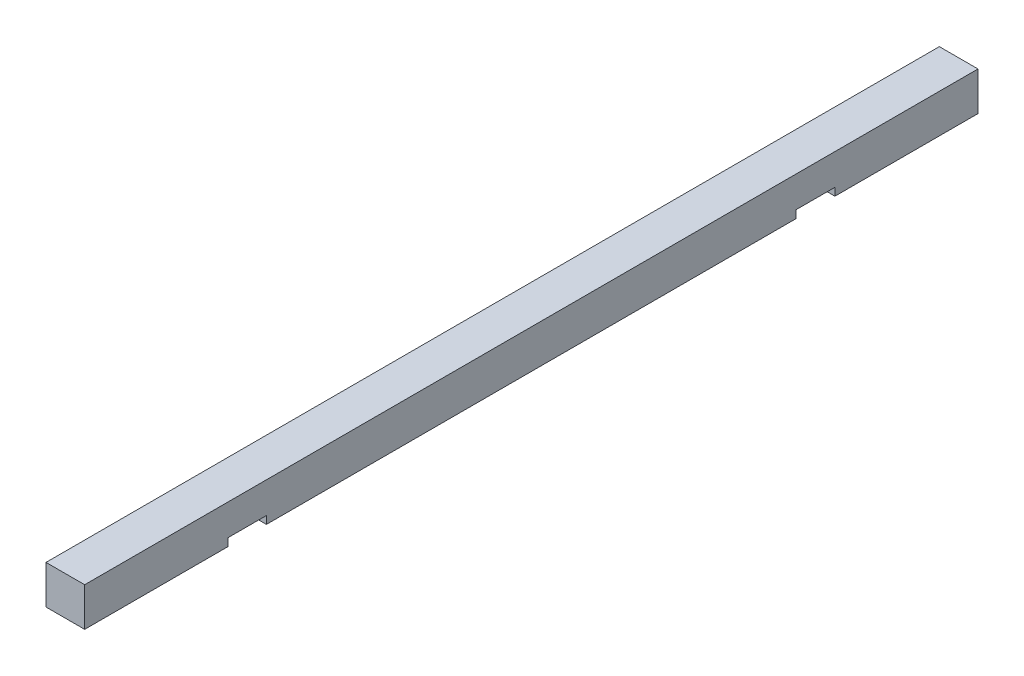
from build123d import *

# Parameters (mm, degrees)
ESQUISSE1_W             = 10
ESQUISSE1_H             = 10
BOSS_EXTRU_1_DEPTH      = 231
ESQUISSE2_W             = 10
ESQUISSE2_H             = 10
ENL_V_MAT_EXTRU_1_DEPTH = 2
ESQUISSE3_W             = 10
ESQUISSE3_H             = 10
ENL_V_MAT_EXTRU_2_DEPTH = 2


with BuildPart() as part:
    # Esquisse1 → Boss.-Extru.1 (new body)
    with BuildSketch(Plane.XY):
        with Locations((5, 5)):
            Rectangle(ESQUISSE1_W, ESQUISSE1_H)
    extrude(amount=BOSS_EXTRU_1_DEPTH)

    # Esquisse2 → Enlèv. mat.-Extru.1 (cut)
    with BuildSketch(Plane.XZ):
        with Locations((5, 189)):
            Rectangle(ESQUISSE2_W, ESQUISSE2_H)
    extrude(amount=-ENL_V_MAT_EXTRU_1_DEPTH, mode=Mode.SUBTRACT)

    # Esquisse3 → Enlèv. mat.-Extru.2 (cut)
    with BuildSketch(Plane.XZ):
        with Locations((5, 42)):
            Rectangle(ESQUISSE3_W, ESQUISSE3_H)
    extrude(amount=-ENL_V_MAT_EXTRU_2_DEPTH, mode=Mode.SUBTRACT)


solid = part.part
